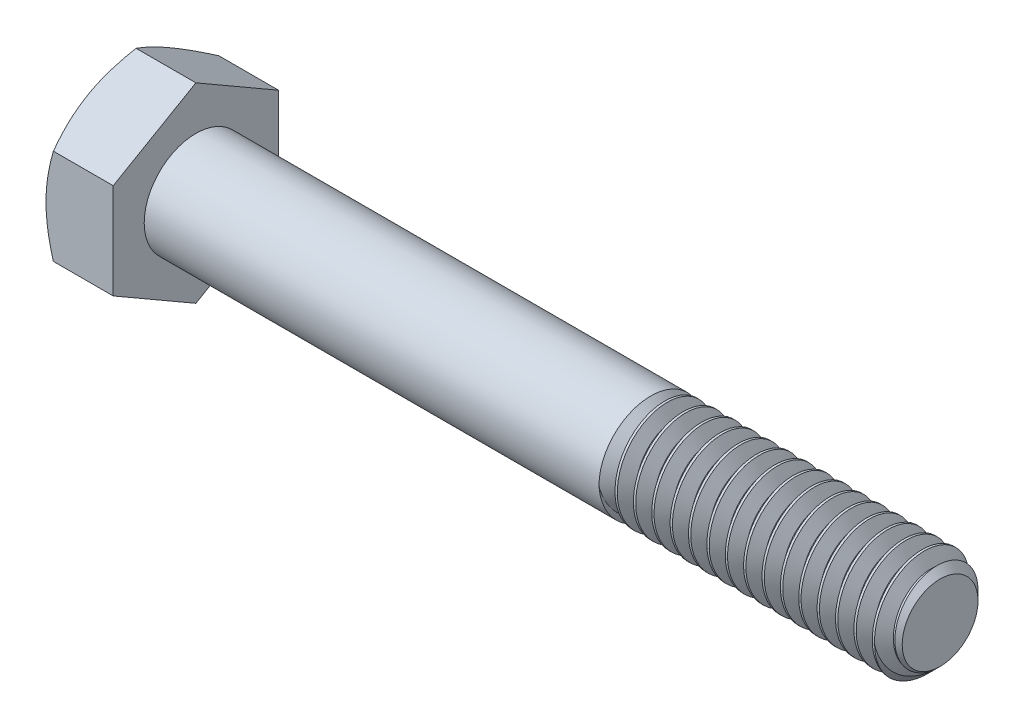
from build123d import *

# Parameters (mm, degrees)
SKETCH5_R           = 3.96875
BOSS_EXTRUDE3_DEPTH = 57.15
CHAMFER1_SIZE       = 1.058333333
CUT_SWEEP1_PITCH    = 1.411111111
BOSS_EXTRUDE4_DEPTH = 5.159375
SKETCH8_OUTSIDE_W   = 249.662
SKETCH8_OUTSIDE_H   = 251.626
SKETCH8_OUTSIDE_R   = 6.35
CUT_EXTRUDE3_DEPTH  = 64.059845058
CUT_EXTRUDE3_DRAFT  = -60
CUT_EXTRUDE4_DEPTH  = 0.254
CIRPATTERN1_COUNT   = 3


with BuildPart() as part:
    # Sketch5 → Boss-Extrude3 (new body)
    with BuildSketch(Plane(origin=(31.1546875, 0, 0), x_dir=(0, 0, -1), z_dir=(1, 0, 0))):
        Circle(SKETCH5_R)
    extrude(amount=-BOSS_EXTRUDE3_DEPTH)

    # Chamfer1
    chamfer1_edges = [part.edges().sort_by_distance(p)[0] for p in [
        (31.1546875, 0, 3.96875),
    ]]
    chamfer(chamfer1_edges, length=CHAMFER1_SIZE)

    # Cut-Sweep1: the profile of Sketch10 profile screwed along a right-hand helix of 16.75 turns, 8 arcs to a turn; built about Z, then put on its axis
    cut_sweep1_z = Axis((0, 0, 0), (0, 0, 1))
    cut_sweep1_corners = [(3.96905, 0, 0.000173205), (3.052206448, 0, -0.529166667), (3.052206448, 0, -0.705555556), (3.96905, 0, -1.234895427)]
    with BuildLine(mode=Mode.PRIVATE) as cut_sweep1_profile:
        Line(cut_sweep1_corners[0], cut_sweep1_corners[1])
        Line(cut_sweep1_corners[1], cut_sweep1_corners[2])
        Line(cut_sweep1_corners[2], cut_sweep1_corners[3])
        Line(cut_sweep1_corners[3], cut_sweep1_corners[0])
    cut_sweep1_cap = Face(cut_sweep1_profile.wire())
    cut_sweep1_turn_angles = [0, 22.5, 45, 67.5, 90, 112.5, 135, 157.5, 180, 202.5, 225, 247.5, 270, 292.5, 315, 337.5, 360]
    cut_sweep1_turn_weights = [1, 0.9238795325112867, 1, 0.9238795325112867, 1, 0.9238795325112867, 1, 0.9238795325112867, 1, 0.9238795325112867, 1, 0.9238795325112867, 1, 0.9238795325112867, 1, 0.9238795325112867, 1]
    cut_sweep1_turn_rails = [Edge.make_bspline([Vector(p[0], p[1], 0).rotate(cut_sweep1_z, cut_sweep1_turn_angles[k]) / cut_sweep1_turn_weights[k] + Vector(0, 0, p[2] + CUT_SWEEP1_PITCH * cut_sweep1_turn_angles[k] / 360) for k in range(17)], [0, 0, 0, 1, 1, 2, 2, 3, 3, 4, 4, 5, 5, 6, 6, 7, 7, 8, 8, 8], 2, cut_sweep1_turn_weights) for p in cut_sweep1_corners]
    cut_sweep1_turn_sides = [Face.make_surface_from_curves(cut_sweep1_turn_rails[p[0]], cut_sweep1_turn_rails[p[1]]) for p in [(0, 1), (1, 2), (2, 3), (3, 0)]]
    cut_sweep1_last_angles = [5760, 5782.5, 5805, 5827.5, 5850, 5872.5, 5895, 5917.5, 5940, 5962.5, 5985, 6007.5, 6030]
    cut_sweep1_last_weights = [1, 0.9238795325112867, 1, 0.9238795325112867, 1, 0.9238795325112867, 1, 0.9238795325112867, 1, 0.9238795325112867, 1, 0.9238795325112473, 1]
    cut_sweep1_last_rails = [Edge.make_bspline([Vector(p[0], p[1], 0).rotate(cut_sweep1_z, cut_sweep1_last_angles[k]) / cut_sweep1_last_weights[k] + Vector(0, 0, p[2] + CUT_SWEEP1_PITCH * cut_sweep1_last_angles[k] / 360) for k in range(13)], [0, 0, 0, 1, 1, 2, 2, 3, 3, 4, 4, 5, 5, 6, 6, 6], 2, cut_sweep1_last_weights) for p in cut_sweep1_corners]
    cut_sweep1_last_sides = [Face.make_surface_from_curves(cut_sweep1_last_rails[p[0]], cut_sweep1_last_rails[p[1]]) for p in [(0, 1), (1, 2), (2, 3), (3, 0)]]
    cut_sweep1 = Plane(origin=(31.1546875, 0, 0), x_dir=(0, 1, 0), z_dir=(-1, 0, 0)) * Solid(Shell([*[p.moved(Location((0, 0, CUT_SWEEP1_PITCH * i))) for i in range(16) for p in cut_sweep1_turn_sides], *cut_sweep1_last_sides, cut_sweep1_cap, cut_sweep1_cap.rotate(cut_sweep1_z, 6030).moved(Location((0, 0, CUT_SWEEP1_PITCH * 6030 / 360)))]))
    add(cut_sweep1, mode=Mode.SUBTRACT)

    # Sketch11 → Revolve1 (revolve)
    with BuildSketch(Plane.XY, mode=Mode.PRIVATE) as revolve1_sk:
        Polygon((-25.9953125, 3.96875), (-25.9953125, 0), (12.8984375, 0), (8.9296875, 3.96875), align=None)
    revolve(revolve1_sk.sketch.rotate(Axis((-25.9953125, 0, 0), (1, 0, 0)), 270), axis=Axis((-25.9953125, 0, 0), (1, 0, 0)))

    # Sketch6 → Boss-Extrude4 (add)
    with BuildSketch(Plane.ZY.offset(25.9953125)):
        Polygon((6.35, 3.666174209), (0, 7.332348419), (-6.35, 3.666174209), (-6.35, -3.666174209), (0, -7.332348419), (6.35, -3.666174209), align=None)
    extrude(amount=BOSS_EXTRUDE4_DEPTH)


with BuildPart() as cut_extrude3_tool:
    # Sketch8 outside → Cut-Extrude3 (with draft: the straight prism first)
    with BuildSketch(Plane.ZY.offset(31.1546875)):
        Rectangle(SKETCH8_OUTSIDE_W, SKETCH8_OUTSIDE_H)
        Circle(SKETCH8_OUTSIDE_R, mode=Mode.SUBTRACT)
    extrude(amount=-CUT_EXTRUDE3_DEPTH)
    # Cut-Extrude3: the draft: its side faces are tilted about the plane it starts from
    cut_extrude3_sides = [cut_extrude3_tool.faces().sort_by_distance(p)[0] for p in [
        (0.875235029, -125.813, 0),
        (0.875235029, 0, 124.831),
        (0.875235029, 125.813, 0),
        (0.875235029, 0, -124.831),
        (0.875235029, 0, -6.35),
    ]]
    draft(cut_extrude3_sides, Plane.ZY.offset(31.1546875), CUT_EXTRUDE3_DRAFT)


with BuildPart() as part_1:
    add(part.part)

    # Cut-Extrude3: cut by cut_extrude3_tool
    add(cut_extrude3_tool.part, mode=Mode.SUBTRACT)

    # Sketch12 → Cut-Extrude4 (cut)
    with BuildSketch(Plane.ZY.offset(31.1546875)):
        with BuildLine():
            Line((0.1905, 4.8895), (0.1905, 2.7305))
            ThreePointArc((0.1905, 2.7305), (0, 2.54), (-0.1905, 2.7305))
            Line((-0.1905, 2.7305), (-0.1905, 4.8895))
            ThreePointArc((-0.1905, 4.8895), (0, 5.08), (0.1905, 4.8895))
        make_face()
    cut_extrude4 = extrude(amount=-CUT_EXTRUDE4_DEPTH, mode=Mode.SUBTRACT)

    # CirPattern1: Cut-Extrude4 ×3 about axis
    cirpattern1_axis = Axis((0, 0, 0), (1, 0, 0))
    for i in range(1, CIRPATTERN1_COUNT):
        add(cut_extrude4.rotate(cirpattern1_axis, i * 360 / CIRPATTERN1_COUNT), mode=Mode.SUBTRACT)


solid = part_1.part
